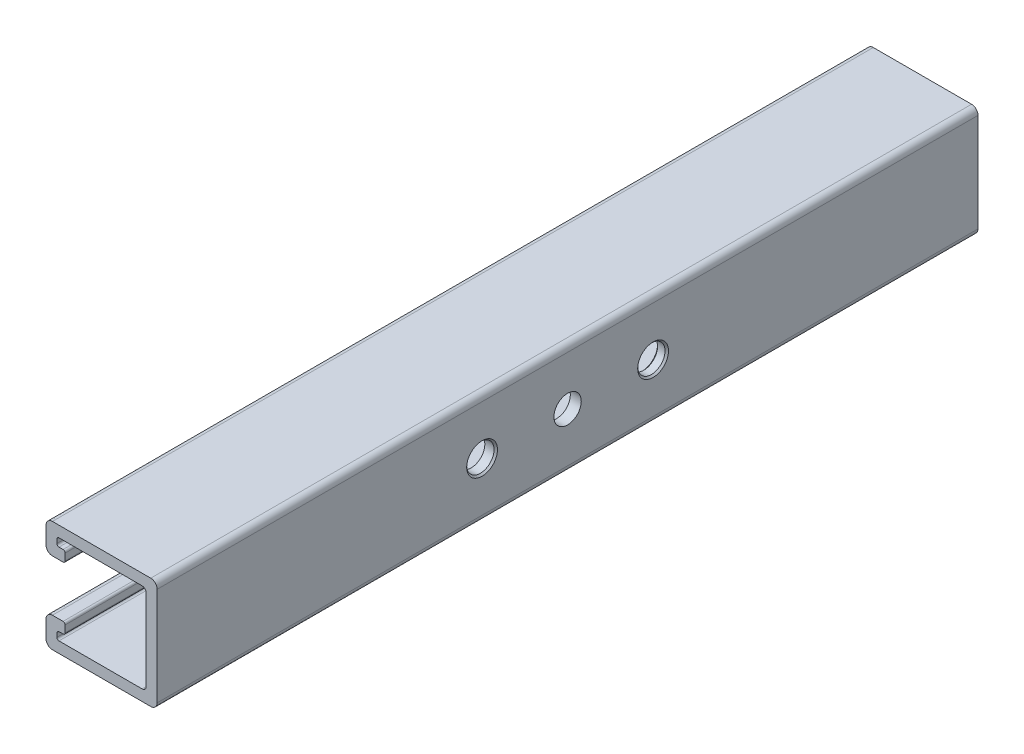
from build123d import *

# Parameters (mm, degrees)
EXTRUDE_THIN1_DEPTH = 304.8
FILLET2_R           = 0.762
FILLET3_R           = 1.524
SKETCH4_R           = 5.08
CUT_EXTRUDE1_DEPTH  = 309.273534432
CHAMFER1_SIZE       = 0.635


with BuildPart() as part:
    # Sketch1 → Extrude-Thin1 (new body)
    with BuildSketch(Plane.XY):
        with BuildLine():
            Line((-13.5255, 9.525), (-18.2499, 9.525))
            ThreePointArc((-18.2499, 9.525), (-19.938188151, 10.224311849), (-20.6375, 11.9126))
            Line((-20.6375, 11.9126), (-20.6375, 18.2499))
            ThreePointArc((-20.6375, 18.2499), (-19.938188151, 19.938188151), (-18.2499, 20.6375))
            Line((-18.2499, 20.6375), (18.2499, 20.6375))
            ThreePointArc((18.2499, 20.6375), (19.938188151, 19.938188151), (20.6375, 18.2499))
            Line((20.6375, 18.2499), (20.6375, -18.2499))
            ThreePointArc((20.6375, -18.2499), (19.938188151, -19.938188151), (18.2499, -20.6375))
            Line((18.2499, -20.6375), (-18.2499, -20.6375))
            ThreePointArc((-18.2499, -20.6375), (-19.938188151, -19.938188151), (-20.6375, -18.2499))
            Line((-20.6375, -18.2499), (-20.6375, -11.9126))
            ThreePointArc((-20.6375, -11.9126), (-19.938188151, -10.224311849), (-18.2499, -9.525))
            Line((-18.2499, -9.525), (-13.5255, -9.525))
            Line((-13.5255, -9.525), (-13.5255, -13.589))
            Line((-13.5255, -13.589), (-16.5735, -13.589))
            Line((-16.5735, -13.589), (-16.5735, -16.5735))
            Line((-16.5735, -16.5735), (16.5735, -16.5735))
            Line((16.5735, -16.5735), (16.5735, 16.5735))
            Line((16.5735, 16.5735), (-16.5735, 16.5735))
            Line((-16.5735, 16.5735), (-16.5735, 13.589))
            Line((-16.5735, 13.589), (-13.5255, 13.589))
            Line((-13.5255, 13.589), (-13.5255, 9.525))
        make_face()
    extrude(amount=-EXTRUDE_THIN1_DEPTH)

    # Fillet2
    fillet2_edges = [part.edges().sort_by_distance(p)[0] for p in [
        (-16.5735, 13.589, -152.4),
        (-16.5735, -16.5735, -152.4),
        (-16.5735, 16.5735, -152.4),
        (-13.5255, 13.589, -152.4),
        (-13.5255, 9.525, -152.4),
        (-13.5255, -9.525, -152.4),
        (-13.5255, -13.589, -152.4),
        (-16.5735, -13.589, -152.4),
    ]]
    fillet(fillet2_edges, radius=FILLET2_R)

    # Fillet3
    fillet3_edges = [part.edges().sort_by_distance(p)[0] for p in [
        (16.5735, 16.5735, -152.4),
        (16.5735, -16.5735, -152.4),
    ]]
    fillet(fillet3_edges, radius=FILLET3_R)

    # Sketch4 → Cut-Extrude1 (cut, through all)
    with BuildSketch(Plane(origin=(20.6375, 0, 0), x_dir=(0, 0, -1), z_dir=(1, 0, 0))):
        with Locations((152.4, 0)):
            Circle(SKETCH4_R)
        with Locations((184.15, 0)):
            Circle(SKETCH4_R)
        with Locations((120.65, 0)):
            Circle(SKETCH4_R)
    extrude(amount=-CUT_EXTRUDE1_DEPTH, mode=Mode.SUBTRACT)

    # Chamfer1
    chamfer1_edges = [part.edges().sort_by_distance(p)[0] for p in [
        (20.6375, 0, -115.57),
        (16.5735, 0, -179.07),
        (20.6375, 0, -179.07),
    ]]
    chamfer(chamfer1_edges, length=CHAMFER1_SIZE)


solid = part.part
